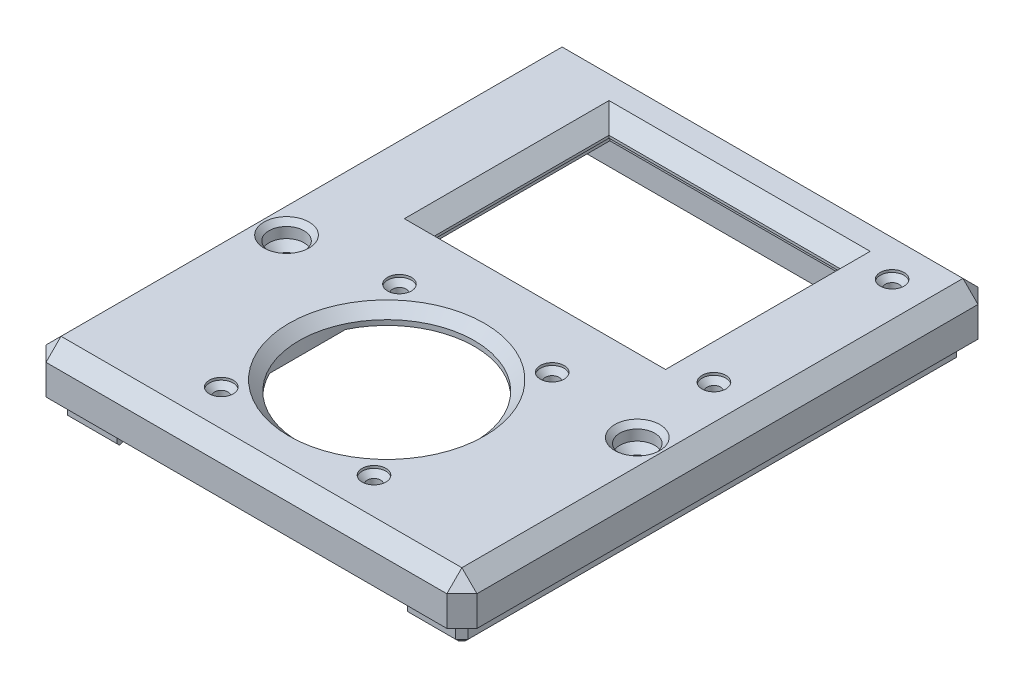
from build123d import *

# Parameters (mm, degrees)
SKETCH1_W                              = 86
SKETCH1_H                              = 106
MAIN_BASE_DEPTH                        = 9
ANO_MAIN_WHEEL_HOLE_DEPTH              = 69.840395118
ANO_MAIN_WHEEL_HOLE_DEPTH_BACK         = 69.840395118
SKETCH2_R                              = 17.5
ANO_MAIN_WHEEL_HOLE_CHAMFER_SIZE       = 2
ANO_MOUNT_HOLES_CUT_DEPTH              = 69.840395118
ANO_MOUNT_HOLES_CUT_DEPTH_BACK         = 69.840395118
SKETCH3_R                              = 1.35
ANO_BOARD_OFFSET_CUT_DEPTH             = 6
ANO_BOARD_INSERT_CUT_DEPTH             = 4
ANO_OFFSET_CHAMFER_SIZE                = 2
ANO_BOARD_INSERT_CHAMFER_SIZE          = 4
SKETCH7_R                              = 2.375
ANO_SCREW_COUNTERSINK_CUT_DEPTH        = 2.5
ANO_SCREW_COUNTERSINK_CHAMFER_SIZE     = 2
SKETCH8_W                              = 46.12
SKETCH8_H                              = 34.84
DISPLAY_MAIN_CUT_DEPTH                 = 69.840395118
DISPLAY_CHAMFER_SIZE                   = 3
SKETCH9_W                              = 56.2
SKETCH9_H                              = 41.1
DISPLAY_OFFSET_CUT_DEPTH               = 5.5
SKETCH10_R                             = 1.35
DISPLAY_MOUNT_HOLES_CUT_DEPTH          = 69.840395118
SKETCH14_R                             = 1.225
DISPLAY_SECONDARY_MOUNT_HOLES_DEPTH    = 6
SKETCH11_R                             = 2.375
DISPLAY_SCREW_COUNTERSINK_DEPTH        = 2.5
DISPLAY_SCREW_COUNTERSINK_CHAMFER_SIZE = 2
SKETCH13_W                             = 68.25
SKETCH13_H                             = 41.25
DISPLAY_SURFACE_OFFSET_CUT_DEPTH       = 2
DISPLAY_BACK_CHAMFER_SIZE              = 2
DISPLAY_WIRE_SPACER_CUT_DEPTH          = 3.5
FRONT_FACE_EDGE_CHAMFER_SIZE           = 3
SCREW_SEAT_LIP_EXTRUDE_DEPTH           = 5
SEAT_LIP_EDGE_EXTRUDE_DEPTH            = 5
SEAT_LIP_ENTRY_CHAMFER_SIZE            = 0.734562784
SEAT_LIP_ENTRY_CHAMFER_SIZE_2          = 1
SEAT_LIP_INNER_CHAMFER_SIZE            = 1
SEAT_LIP_BASE_CHAMFER_SIZE             = 1
SKETCH21_R                             = 2.1
BOX_MOUNTING_HOLE_CUT_DEPTH            = 70.670653793
SKETCH22_R                             = 3.5
BOX_MOUNTING_HOLE_COUNTERSINK_DEPTH    = 3
BOX_MOUNTING_HOLE_CHAMFER_SIZE         = 1
BOX_MOUNTING_HOLE_PRINT_CHAMFER_SIZE   = 1.5


# Some blends are built 0.0001 mm under size
with BuildPart() as part:
    # Sketch1 → Main Base (new body)
    with BuildSketch(Plane(origin=(0, 0, 0), x_dir=(1, 0, 0), z_dir=(0, 1, 0))):
        Rectangle(SKETCH1_W, SKETCH1_H)
    extrude(amount=MAIN_BASE_DEPTH)

    # Sketch2 → ANO Main Wheel Hole (cut, two sides: drawn at the far end of the back side and taken through both)
    with BuildSketch(Plane.XZ.offset(-ANO_MAIN_WHEEL_HOLE_DEPTH_BACK)):
        with Locations(Location((0, 25, 0), (0, 0, 270))):
            Circle(SKETCH2_R)
    extrude(amount=ANO_MAIN_WHEEL_HOLE_DEPTH + ANO_MAIN_WHEEL_HOLE_DEPTH_BACK, mode=Mode.SUBTRACT)

    # ANO Main Wheel Hole Chamfer
    ano_main_wheel_hole_chamfer_edges = [part.edges().sort_by_distance(p)[0] for p in [
        (0, 9, 42.5),
    ]]
    chamfer(ano_main_wheel_hole_chamfer_edges, length=ANO_MAIN_WHEEL_HOLE_CHAMFER_SIZE)

    # Sketch3 → ANO Mount Holes Cut (cut, two sides: drawn at the far end of the back side and taken through both)
    with BuildSketch(Plane.XZ.offset(-ANO_MOUNT_HOLES_CUT_DEPTH_BACK)):
        with Locations(Location((-15.24, 42.78, 0), (0, 0, 270))):
            Circle(SKETCH3_R)
        with Locations(Location((15.24, 42.78, 0), (0, 0, 270))):
            Circle(SKETCH3_R)
        with Locations(Location((15.24, 7.22, 0), (0, 0, 270))):
            Circle(SKETCH3_R)
        with Locations(Location((-15.24, 7.22, 0), (0, 0, 270))):
            Circle(SKETCH3_R)
    extrude(amount=ANO_MOUNT_HOLES_CUT_DEPTH + ANO_MOUNT_HOLES_CUT_DEPTH_BACK, mode=Mode.SUBTRACT)

    # Sketch6 → ANO Board Offset Cut (cut)
    with BuildSketch(Plane.XZ):
        with BuildLine():
            Line((-17.78, 25), (-17.78, 37.7))
            ThreePointArc((-17.78, 37.7), (-17.036051224, 39.496051224), (-15.24, 40.24))
            ThreePointArc((-15.24, 40.24), (-13.443948776, 40.983948776), (-12.7, 42.78))
            ThreePointArc((-12.7, 42.78), (-11.956051224, 44.576051224), (-10.16, 45.32))
            Line((-10.16, 45.32), (10.16, 45.32))
            ThreePointArc((10.16, 45.32), (11.956051224, 44.576051224), (12.7, 42.78))
            ThreePointArc((12.7, 42.78), (13.443948776, 40.983948776), (15.24, 40.24))
            ThreePointArc((15.24, 40.24), (17.036051224, 39.496051224), (17.78, 37.7))
            Line((17.78, 37.7), (17.78, 25))
            Line((17.78, 25), (17.78, 12.3))
            ThreePointArc((17.78, 12.3), (17.036051224, 10.503948776), (15.24, 9.76))
            ThreePointArc((15.24, 9.76), (13.443948776, 9.016051224), (12.7, 7.22))
            ThreePointArc((12.7, 7.22), (11.956051224, 5.423948776), (10.16, 4.68))
            Line((10.16, 4.68), (-10.16, 4.68))
            ThreePointArc((-10.16, 4.68), (-11.956051224, 5.423948776), (-12.7, 7.22))
            ThreePointArc((-12.7, 7.22), (-13.443948776, 9.016051224), (-15.24, 9.76))
            ThreePointArc((-15.24, 9.76), (-17.036051224, 10.503948776), (-17.78, 12.3))
            Line((-17.78, 12.3), (-17.78, 25))
        make_face()
    extrude(amount=-ANO_BOARD_OFFSET_CUT_DEPTH, mode=Mode.SUBTRACT)

    # Sketch12 → ANO Board Insert Cut (cut)
    with BuildSketch(Plane.XZ):
        with BuildLine():
            Line((18.28, 42.78), (18.28, 7.22))
            ThreePointArc((18.28, 7.22), (17.389604615, 5.070395385), (15.24, 4.18))
            Line((15.24, 4.18), (-15.24, 4.18))
            ThreePointArc((-15.24, 4.18), (-17.389604615, 5.070395385), (-18.28, 7.22))
            Line((-18.28, 7.22), (-18.28, 42.78))
            ThreePointArc((-18.28, 42.78), (-17.389604615, 44.929604615), (-15.24, 45.82))
            Line((-15.24, 45.82), (15.24, 45.82))
            ThreePointArc((15.24, 45.82), (17.389604615, 44.929604615), (18.28, 42.78))
        make_face()
    extrude(amount=-ANO_BOARD_INSERT_CUT_DEPTH, mode=Mode.SUBTRACT)

    # ANO Offset Chamfer
    # the kernel refuses this chamfer: 2 mm, written as the material it adds along each edge
    with BuildSketch(Plane(origin=(-10.16, 6, 42.78), x_dir=(-1, 0, 0), z_dir=(0, 0, -1))) as ano_offset_chamfer_piece_1_section:
        Polygon((2.54, -ANO_OFFSET_CHAMFER_SIZE), (2.54 - ANO_OFFSET_CHAMFER_SIZE, 0), (2.54, 0), align=None)
    ano_offset_chamfer_piece_1 = revolve(axis=Axis((-10.16, 6, 42.78), (0, 1, 0)), revolution_arc=90, mode=Mode.PRIVATE)
    ano_offset_chamfer_piece_1 = split(ano_offset_chamfer_piece_1, bisect_by=Plane(origin=(-10.16, 4, 42.78), z_dir=(0, 1, 0)), keep=Keep.TOP, mode=Mode.PRIVATE)
    add(ano_offset_chamfer_piece_1)
    with BuildSketch(Plane(origin=(-15.24, 6, 42.78), x_dir=(0, 0, -1), z_dir=(-1, 0, 0))) as ano_offset_chamfer_piece_2_section:
        Polygon((2.54, ANO_OFFSET_CHAMFER_SIZE), (2.54 + ANO_OFFSET_CHAMFER_SIZE, 0), (2.54, 0), align=None)
    ano_offset_chamfer_piece_2 = revolve(axis=Axis((-15.24, 6, 42.78), (0, -1, 0)), revolution_arc=90, mode=Mode.PRIVATE)
    ano_offset_chamfer_piece_2 = split(ano_offset_chamfer_piece_2, bisect_by=Plane(origin=(-15.24, 4, 42.78), z_dir=(0, 1, 0)), keep=Keep.TOP, mode=Mode.PRIVATE)
    add(ano_offset_chamfer_piece_2)
    with BuildSketch(Plane(origin=(-15.24, 6, 37.7), x_dir=(-1, 0, 0), z_dir=(0, 0, -1))) as ano_offset_chamfer_piece_3_section:
        Polygon((2.54, -ANO_OFFSET_CHAMFER_SIZE), (2.54 - ANO_OFFSET_CHAMFER_SIZE, 0), (2.54, 0), align=None)
    ano_offset_chamfer_piece_3 = revolve(axis=Axis((-15.24, 6, 37.7), (0, 1, 0)), revolution_arc=90, mode=Mode.PRIVATE)
    ano_offset_chamfer_piece_3 = split(ano_offset_chamfer_piece_3, bisect_by=Plane(origin=(-15.24, 4, 37.7), z_dir=(0, 1, 0)), keep=Keep.TOP, mode=Mode.PRIVATE)
    add(ano_offset_chamfer_piece_3)
    with BuildSketch(Plane(origin=(17.78, 6, 12.3), x_dir=(0, -1, 0), z_dir=(0, 0, 1))) as ano_offset_chamfer_piece_4_section:
        Polygon((ANO_OFFSET_CHAMFER_SIZE, 0), (0, -ANO_OFFSET_CHAMFER_SIZE), (0, 0), align=None)
    ano_offset_chamfer_piece_4 = extrude(amount=25.4, mode=Mode.PRIVATE)
    ano_offset_chamfer_piece_4 = split(ano_offset_chamfer_piece_4, bisect_by=Plane(origin=(17.78, 4, 12.3), z_dir=(0, 1, 0)), keep=Keep.TOP, mode=Mode.PRIVATE)
    ano_offset_chamfer_piece_4 = ano_offset_chamfer_piece_4 - Plane(origin=(0, 6, 25), x_dir=(0, 0, -1), z_dir=(0, -1, 0)) * Cylinder(17.5, 59, mode=Mode.PRIVATE)
    add(ano_offset_chamfer_piece_4)
    with BuildSketch(Plane(origin=(10.16, 6, 7.22), x_dir=(1, 0, 0), z_dir=(0, 0, 1))) as ano_offset_chamfer_piece_5_section:
        Polygon((2.54, -ANO_OFFSET_CHAMFER_SIZE), (2.54 - ANO_OFFSET_CHAMFER_SIZE, 0), (2.54, 0), align=None)
    ano_offset_chamfer_piece_5 = revolve(axis=Axis((10.16, 6, 7.22), (0, 1, 0)), revolution_arc=90, mode=Mode.PRIVATE)
    ano_offset_chamfer_piece_5 = split(ano_offset_chamfer_piece_5, bisect_by=Plane(origin=(10.16, 4, 7.22), z_dir=(0, 1, 0)), keep=Keep.TOP, mode=Mode.PRIVATE)
    add(ano_offset_chamfer_piece_5)
    with BuildSketch(Plane(origin=(10.16, 6, 4.68), x_dir=(0, -1, 0), z_dir=(-1, 0, 0))) as ano_offset_chamfer_piece_6_section:
        Polygon((ANO_OFFSET_CHAMFER_SIZE, 0), (0, ANO_OFFSET_CHAMFER_SIZE), (0, 0), align=None)
    ano_offset_chamfer_piece_6 = extrude(amount=20.32, mode=Mode.PRIVATE)
    ano_offset_chamfer_piece_6 = split(ano_offset_chamfer_piece_6, bisect_by=Plane(origin=(10.16, 4, 4.68), z_dir=(0, 1, 0)), keep=Keep.TOP, mode=Mode.PRIVATE)
    add(ano_offset_chamfer_piece_6)
    with BuildSketch(Plane(origin=(15.24, 6, 7.22), x_dir=(0, 0, 1), z_dir=(1, 0, 0))) as ano_offset_chamfer_piece_7_section:
        Polygon((2.54, ANO_OFFSET_CHAMFER_SIZE), (2.54 + ANO_OFFSET_CHAMFER_SIZE, 0), (2.54, 0), align=None)
    ano_offset_chamfer_piece_7 = revolve(axis=Axis((15.24, 6, 7.22), (0, -1, 0)), revolution_arc=90, mode=Mode.PRIVATE)
    ano_offset_chamfer_piece_7 = split(ano_offset_chamfer_piece_7, bisect_by=Plane(origin=(15.24, 4, 7.22), z_dir=(0, 1, 0)), keep=Keep.TOP, mode=Mode.PRIVATE)
    add(ano_offset_chamfer_piece_7)
    with BuildSketch(Plane(origin=(-10.16, 6, 7.22), x_dir=(0, 0, -1), z_dir=(1, 0, 0))) as ano_offset_chamfer_piece_8_section:
        Polygon((2.54, -ANO_OFFSET_CHAMFER_SIZE), (2.54 - ANO_OFFSET_CHAMFER_SIZE, 0), (2.54, 0), align=None)
    ano_offset_chamfer_piece_8 = revolve(axis=Axis((-10.16, 6, 7.22), (0, 1, 0)), revolution_arc=90, mode=Mode.PRIVATE)
    ano_offset_chamfer_piece_8 = split(ano_offset_chamfer_piece_8, bisect_by=Plane(origin=(-10.16, 4, 7.22), z_dir=(0, 1, 0)), keep=Keep.TOP, mode=Mode.PRIVATE)
    add(ano_offset_chamfer_piece_8)
    with BuildSketch(Plane(origin=(15.24, 6, 12.3), x_dir=(1, 0, 0), z_dir=(0, 0, 1))) as ano_offset_chamfer_piece_9_section:
        Polygon((2.54, -ANO_OFFSET_CHAMFER_SIZE), (2.54 - ANO_OFFSET_CHAMFER_SIZE, 0), (2.54, 0), align=None)
    ano_offset_chamfer_piece_9 = revolve(axis=Axis((15.24, 6, 12.3), (0, 1, 0)), revolution_arc=90, mode=Mode.PRIVATE)
    ano_offset_chamfer_piece_9 = split(ano_offset_chamfer_piece_9, bisect_by=Plane(origin=(15.24, 4, 12.3), z_dir=(0, 1, 0)), keep=Keep.TOP, mode=Mode.PRIVATE)
    add(ano_offset_chamfer_piece_9)
    with BuildSketch(Plane(origin=(-15.24, 6, 7.22), x_dir=(1, 0, 0), z_dir=(0, 0, -1))) as ano_offset_chamfer_piece_10_section:
        Polygon((2.54, ANO_OFFSET_CHAMFER_SIZE), (2.54 + ANO_OFFSET_CHAMFER_SIZE, 0), (2.54, 0), align=None)
    ano_offset_chamfer_piece_10 = revolve(axis=Axis((-15.24, 6, 7.22), (0, -1, 0)), revolution_arc=90, mode=Mode.PRIVATE)
    ano_offset_chamfer_piece_10 = split(ano_offset_chamfer_piece_10, bisect_by=Plane(origin=(-15.24, 4, 7.22), z_dir=(0, 1, 0)), keep=Keep.TOP, mode=Mode.PRIVATE)
    add(ano_offset_chamfer_piece_10)
    with BuildSketch(Plane(origin=(-15.24, 6, 12.3), x_dir=(0, 0, -1), z_dir=(1, 0, 0))) as ano_offset_chamfer_piece_11_section:
        Polygon((2.54, -ANO_OFFSET_CHAMFER_SIZE), (2.54 - ANO_OFFSET_CHAMFER_SIZE, 0), (2.54, 0), align=None)
    ano_offset_chamfer_piece_11 = revolve(axis=Axis((-15.24, 6, 12.3), (0, 1, 0)), revolution_arc=90, mode=Mode.PRIVATE)
    ano_offset_chamfer_piece_11 = split(ano_offset_chamfer_piece_11, bisect_by=Plane(origin=(-15.24, 4, 12.3), z_dir=(0, 1, 0)), keep=Keep.TOP, mode=Mode.PRIVATE)
    add(ano_offset_chamfer_piece_11)
    with BuildSketch(Plane(origin=(15.24, 6, 37.7), x_dir=(0, 0, 1), z_dir=(-1, 0, 0))) as ano_offset_chamfer_piece_12_section:
        Polygon((2.54, -ANO_OFFSET_CHAMFER_SIZE), (2.54 - ANO_OFFSET_CHAMFER_SIZE, 0), (2.54, 0), align=None)
    ano_offset_chamfer_piece_12 = revolve(axis=Axis((15.24, 6, 37.7), (0, 1, 0)), revolution_arc=90, mode=Mode.PRIVATE)
    ano_offset_chamfer_piece_12 = split(ano_offset_chamfer_piece_12, bisect_by=Plane(origin=(15.24, 4, 37.7), z_dir=(0, 1, 0)), keep=Keep.TOP, mode=Mode.PRIVATE)
    add(ano_offset_chamfer_piece_12)
    with BuildSketch(Plane(origin=(-17.78, 6, 37.7), x_dir=(0, -1, 0), z_dir=(0, 0, -1))) as ano_offset_chamfer_piece_13_section:
        Polygon((ANO_OFFSET_CHAMFER_SIZE, 0), (0, -ANO_OFFSET_CHAMFER_SIZE), (0, 0), align=None)
    ano_offset_chamfer_piece_13 = extrude(amount=25.4, mode=Mode.PRIVATE)
    ano_offset_chamfer_piece_13 = split(ano_offset_chamfer_piece_13, bisect_by=Plane(origin=(-17.78, 4, 37.7), z_dir=(0, 1, 0)), keep=Keep.TOP, mode=Mode.PRIVATE)
    ano_offset_chamfer_piece_13 = ano_offset_chamfer_piece_13 - Plane(origin=(0, 6, 25), x_dir=(0, 0, -1), z_dir=(0, -1, 0)) * Cylinder(17.5, 59, mode=Mode.PRIVATE)
    add(ano_offset_chamfer_piece_13)
    with BuildSketch(Plane(origin=(15.24, 6, 42.78), x_dir=(-1, 0, 0), z_dir=(0, 0, 1))) as ano_offset_chamfer_piece_14_section:
        Polygon((2.54, ANO_OFFSET_CHAMFER_SIZE), (2.54 + ANO_OFFSET_CHAMFER_SIZE, 0), (2.54, 0), align=None)
    ano_offset_chamfer_piece_14 = revolve(axis=Axis((15.24, 6, 42.78), (0, -1, 0)), revolution_arc=90, mode=Mode.PRIVATE)
    ano_offset_chamfer_piece_14 = split(ano_offset_chamfer_piece_14, bisect_by=Plane(origin=(15.24, 4, 42.78), z_dir=(0, 1, 0)), keep=Keep.TOP, mode=Mode.PRIVATE)
    add(ano_offset_chamfer_piece_14)
    with BuildSketch(Plane(origin=(10.16, 6, 42.78), x_dir=(0, 0, 1), z_dir=(-1, 0, 0))) as ano_offset_chamfer_piece_15_section:
        Polygon((2.54, -ANO_OFFSET_CHAMFER_SIZE), (2.54 - ANO_OFFSET_CHAMFER_SIZE, 0), (2.54, 0), align=None)
    ano_offset_chamfer_piece_15 = revolve(axis=Axis((10.16, 6, 42.78), (0, 1, 0)), revolution_arc=90, mode=Mode.PRIVATE)
    ano_offset_chamfer_piece_15 = split(ano_offset_chamfer_piece_15, bisect_by=Plane(origin=(10.16, 4, 42.78), z_dir=(0, 1, 0)), keep=Keep.TOP, mode=Mode.PRIVATE)
    add(ano_offset_chamfer_piece_15)
    with BuildSketch(Plane(origin=(-10.16, 6, 45.32), x_dir=(0, -1, 0), z_dir=(1, 0, 0))) as ano_offset_chamfer_piece_16_section:
        Polygon((ANO_OFFSET_CHAMFER_SIZE, 0), (0, ANO_OFFSET_CHAMFER_SIZE), (0, 0), align=None)
    ano_offset_chamfer_piece_16 = extrude(amount=20.32, mode=Mode.PRIVATE)
    ano_offset_chamfer_piece_16 = split(ano_offset_chamfer_piece_16, bisect_by=Plane(origin=(-10.16, 4, 45.32), z_dir=(0, 1, 0)), keep=Keep.TOP, mode=Mode.PRIVATE)
    add(ano_offset_chamfer_piece_16)

    # ANO Board Insert Chamfer
    ano_board_insert_chamfer_edges = [part.edges().sort_by_distance(p)[0] for p in [
        (0, 0, 4.18),
        (17.389604615, 0, 5.070395385),
        (-17.389604615, 0, 5.070395385),
        (18.28, 0, 25),
        (-18.28, 0, 25),
        (17.389604615, 0, 44.929604615),
        (-17.389604615, 0, 44.929604615),
        (0, 0, 45.82),
    ]]
    chamfer(ano_board_insert_chamfer_edges, length=ANO_BOARD_INSERT_CHAMFER_SIZE - 0.0001)  # a hair under: the kernel refuses the full size

    # Sketch7 → ANO Screw Countersink Cut (cut)
    with BuildSketch(Plane(origin=(0, 9, 0), x_dir=(1, 0, 0), z_dir=(0, 1, 0))):
        with Locations(Location((-15.24, -7.22, 0), (0, 0, 270))):
            Circle(SKETCH7_R)
        with Locations(Location((-15.24, -42.78, 0), (0, 0, 270))):
            Circle(SKETCH7_R)
        with Locations(Location((15.24, -42.78, 0), (0, 0, 270))):
            Circle(SKETCH7_R)
        with Locations(Location((15.24, -7.22, 0), (0, 0, 270))):
            Circle(SKETCH7_R)
    extrude(amount=-ANO_SCREW_COUNTERSINK_CUT_DEPTH, mode=Mode.SUBTRACT)

    # ANO Screw Countersink Chamfer
    # the kernel refuses this chamfer: 2 mm, written as the material it adds along each edge
    with BuildSketch(Plane(origin=(-15.24, 6.5, 42.78), x_dir=(0, 0, 1), z_dir=(-1, 0, 0))) as ano_screw_countersink_chamfer_piece_1_section:
        Polygon((2.375 - ANO_SCREW_COUNTERSINK_CHAMFER_SIZE, 0), (2.375, ANO_SCREW_COUNTERSINK_CHAMFER_SIZE), (2.375, 0), align=None)
    ano_screw_countersink_chamfer_piece_1 = revolve(axis=Axis((-15.24, 6.5, 42.78), (0, 1, 0)), mode=Mode.PRIVATE)
    ano_screw_countersink_chamfer_piece_1 = ano_screw_countersink_chamfer_piece_1 - Plane(origin=(-15.24, 6.5, 42.78), x_dir=(0, 0, -1), z_dir=(0, -1, 0)) * Cylinder(1.35, 10, mode=Mode.PRIVATE)
    add(ano_screw_countersink_chamfer_piece_1)
    with BuildSketch(Plane(origin=(15.24, 6.5, 42.78), x_dir=(0, 0, 1), z_dir=(-1, 0, 0))) as ano_screw_countersink_chamfer_piece_2_section:
        Polygon((2.375 - ANO_SCREW_COUNTERSINK_CHAMFER_SIZE, 0), (2.375, ANO_SCREW_COUNTERSINK_CHAMFER_SIZE), (2.375, 0), align=None)
    ano_screw_countersink_chamfer_piece_2 = revolve(axis=Axis((15.24, 6.5, 42.78), (0, 1, 0)), mode=Mode.PRIVATE)
    ano_screw_countersink_chamfer_piece_2 = ano_screw_countersink_chamfer_piece_2 - Plane(origin=(15.24, 6.5, 42.78), x_dir=(0, 0, -1), z_dir=(0, -1, 0)) * Cylinder(1.35, 10, mode=Mode.PRIVATE)
    add(ano_screw_countersink_chamfer_piece_2)
    with BuildSketch(Plane(origin=(15.24, 6.5, 7.22), x_dir=(0, 0, 1), z_dir=(-1, 0, 0))) as ano_screw_countersink_chamfer_piece_3_section:
        Polygon((2.375 - ANO_SCREW_COUNTERSINK_CHAMFER_SIZE, 0), (2.375, ANO_SCREW_COUNTERSINK_CHAMFER_SIZE), (2.375, 0), align=None)
    ano_screw_countersink_chamfer_piece_3 = revolve(axis=Axis((15.24, 6.5, 7.22), (0, 1, 0)), mode=Mode.PRIVATE)
    ano_screw_countersink_chamfer_piece_3 = ano_screw_countersink_chamfer_piece_3 - Plane(origin=(15.24, 6.5, 7.22), x_dir=(0, 0, -1), z_dir=(0, -1, 0)) * Cylinder(1.35, 10, mode=Mode.PRIVATE)
    add(ano_screw_countersink_chamfer_piece_3)
    with BuildSketch(Plane(origin=(-15.24, 6.5, 7.22), x_dir=(0, 0, 1), z_dir=(-1, 0, 0))) as ano_screw_countersink_chamfer_piece_4_section:
        Polygon((2.375 - ANO_SCREW_COUNTERSINK_CHAMFER_SIZE, 0), (2.375, ANO_SCREW_COUNTERSINK_CHAMFER_SIZE), (2.375, 0), align=None)
    ano_screw_countersink_chamfer_piece_4 = revolve(axis=Axis((-15.24, 6.5, 7.22), (0, 1, 0)), mode=Mode.PRIVATE)
    ano_screw_countersink_chamfer_piece_4 = ano_screw_countersink_chamfer_piece_4 - Plane(origin=(-15.24, 6.5, 7.22), x_dir=(0, 0, -1), z_dir=(0, -1, 0)) * Cylinder(1.35, 10, mode=Mode.PRIVATE)
    add(ano_screw_countersink_chamfer_piece_4)

    # Sketch8 → Display Main Cut (cut, through all)
    with BuildSketch(Plane(origin=(0, 9, 0), x_dir=(1, 0, 0), z_dir=(0, 1, 0))):
        with Locations((0, 25)):
            Rectangle(SKETCH8_W, SKETCH8_H)
    extrude(amount=-DISPLAY_MAIN_CUT_DEPTH, mode=Mode.SUBTRACT)

    # Display Chamfer
    display_chamfer_edges = [part.edges().sort_by_distance(p)[0] for p in [
        (-23.06, 9, -25),
        (0, 9, -7.58),
        (23.06, 9, -25),
        (0, 9, -42.42),
    ]]
    chamfer(display_chamfer_edges, length=DISPLAY_CHAMFER_SIZE)

    # Sketch9 → Display Offset Cut (cut)
    with BuildSketch(Plane.XZ):
        with Locations((2.08, -25)):
            Rectangle(SKETCH9_W, SKETCH9_H)
    extrude(amount=-DISPLAY_OFFSET_CUT_DEPTH, mode=Mode.SUBTRACT)

    # Sketch10 → Display Mount Holes Cut (cut, through all)
    with BuildSketch(Plane.XZ):
        with Locations(Location((33.08, -42.78, 0), (0, 0, 270))):
            Circle(SKETCH10_R)
        with Locations(Location((33.08, -7.22, 0), (0, 0, 270))):
            Circle(SKETCH10_R)
    extrude(amount=-DISPLAY_MOUNT_HOLES_CUT_DEPTH, mode=Mode.SUBTRACT)

    # Sketch14 → Display Secondary Mount Holes (cut)
    with BuildSketch(Plane.XZ):
        with Locations(Location((-27.88, -7.22, 0), (0, 0, 270))):
            Circle(SKETCH14_R)
        with Locations(Location((-27.88, -42.78, 0), (0, 0, 270))):
            Circle(SKETCH14_R)
    extrude(amount=-DISPLAY_SECONDARY_MOUNT_HOLES_DEPTH, mode=Mode.SUBTRACT)

    # Sketch11 → Display Screw Countersink (cut)
    with BuildSketch(Plane(origin=(0, 9, 0), x_dir=(1, 0, 0), z_dir=(0, 1, 0))):
        with Locations(Location((33.08, 42.78, 0), (0, 0, 270))):
            Circle(SKETCH11_R)
        with Locations(Location((33.08, 7.22, 0), (0, 0, 270))):
            Circle(SKETCH11_R)
    extrude(amount=-DISPLAY_SCREW_COUNTERSINK_DEPTH, mode=Mode.SUBTRACT)

    # Display Screw Countersink Chamfer
    # the kernel refuses this chamfer: 2 mm, written as the material it adds along each edge
    with BuildSketch(Plane(origin=(33.08, 6.5, -42.78), x_dir=(0, 0, 1), z_dir=(-1, 0, 0))) as display_screw_countersink_chamfer_piece_1_section:
        Polygon((2.375, DISPLAY_SCREW_COUNTERSINK_CHAMFER_SIZE), (2.375 - DISPLAY_SCREW_COUNTERSINK_CHAMFER_SIZE, 0), (2.375, 0), align=None)
    display_screw_countersink_chamfer_piece_1 = revolve(axis=Axis((33.08, 6.5, -42.78), (0, 1, 0)), mode=Mode.PRIVATE)
    display_screw_countersink_chamfer_piece_1 = display_screw_countersink_chamfer_piece_1 - Plane(origin=(33.08, 6.5, -42.78), x_dir=(0, 0, -1), z_dir=(0, -1, 0)) * Cylinder(1.35, 10, mode=Mode.PRIVATE)
    add(display_screw_countersink_chamfer_piece_1)
    with BuildSketch(Plane(origin=(33.08, 6.5, -7.22), x_dir=(0, 0, 1), z_dir=(-1, 0, 0))) as display_screw_countersink_chamfer_piece_2_section:
        Polygon((2.375, DISPLAY_SCREW_COUNTERSINK_CHAMFER_SIZE), (2.375 - DISPLAY_SCREW_COUNTERSINK_CHAMFER_SIZE, 0), (2.375, 0), align=None)
    display_screw_countersink_chamfer_piece_2 = revolve(axis=Axis((33.08, 6.5, -7.22), (0, 1, 0)), mode=Mode.PRIVATE)
    display_screw_countersink_chamfer_piece_2 = display_screw_countersink_chamfer_piece_2 - Plane(origin=(33.08, 6.5, -7.22), x_dir=(0, 0, -1), z_dir=(0, -1, 0)) * Cylinder(1.35, 10, mode=Mode.PRIVATE)
    add(display_screw_countersink_chamfer_piece_2)

    # Sketch13 → Display Surface Offset Cut (cut)
    with BuildSketch(Plane.XZ):
        with Locations((2.6, -25)):
            Rectangle(SKETCH13_W, SKETCH13_H)
    extrude(amount=-DISPLAY_SURFACE_OFFSET_CUT_DEPTH, mode=Mode.SUBTRACT)

    # Display Back Chamfer
    display_back_chamfer_edges = [part.edges().sort_by_distance(p)[0] for p in [
        (36.725, 0, -25),
        (2.6, 0, -45.625),
        (-31.525, 0, -25),
        (2.6, 0, -4.375),
    ]]
    chamfer(display_back_chamfer_edges, length=DISPLAY_BACK_CHAMFER_SIZE - 0.0001)  # a hair under: the kernel refuses the full size

    # Sketch16 → Display Wire Spacer Cut (cut)
    with BuildSketch(Plane.XZ.offset(-2)):
        with BuildLine():
            Line((36.725, -13.765), (36.725, -36.235))
            ThreePointArc((36.725, -36.235), (35.657404217, -38.812404217), (33.08, -39.88))
            ThreePointArc((33.08, -39.88), (31.029390335, -40.729390335), (30.18, -42.78))
            Line((30.18, -42.78), (30.18, -7.22))
            ThreePointArc((30.18, -7.22), (31.029390335, -9.270609665), (33.08, -10.12))
            ThreePointArc((33.08, -10.12), (35.657404217, -11.187595783), (36.725, -13.765))
        make_face()
    extrude(amount=-DISPLAY_WIRE_SPACER_CUT_DEPTH, mode=Mode.SUBTRACT)

    # Front Face Edge Chamfer
    front_face_edge_chamfer_edges = [part.edges().sort_by_distance(p)[0] for p in [
        (43, 9, 0),
        (0, 9, -53),
        (-43, 9, 0),
        (-43, 4.5, -53),
        (43, 4.5, -53),
        (43, 4.5, 53),
        (-43, 4.5, 53),
        (0, 9, 53),
    ]]
    chamfer(front_face_edge_chamfer_edges, length=FRONT_FACE_EDGE_CHAMFER_SIZE)

    # Sketch19 → Screw Seat Lip Extrude (add)
    with BuildSketch(Plane.XZ):
        with BuildLine():
            Line((38.757359313, 50), (40, 48.757359313))
            Line((40, 48.757359313), (40, 10))
            ThreePointArc((40, 10), (35, 5), (30, 10))
            Line((30, 10), (30, 42.78))
            ThreePointArc((30, 42.78), (29.52061133, 46.511184805), (28.113585359, 50))
            Line((28.113585359, 50), (38.757359313, 50))
        make_face()
        with BuildLine():
            Line((-30, 42.78), (-30, 10))
            ThreePointArc((-30, 10), (-35, 5), (-40, 10))
            Line((-40, 10), (-40, 48.757359313))
            Line((-40, 48.757359313), (-38.757359313, 50))
            Line((-38.757359313, 50), (-28.113585359, 50))
            ThreePointArc((-28.113585359, 50), (-29.52061133, 46.511184805), (-30, 42.78))
        make_face()
    extrude(amount=SCREW_SEAT_LIP_EXTRUDE_DEPTH)

    # Sketch20 → Seat Lip Edge Extrude (add)
    with BuildSketch(Plane.XZ):
        with BuildLine():
            Line((38.757359313, -48), (-37.928932188, -48))
            Line((-37.928932188, -48), (-38.585786438, -47.343145751))
            Line((-38.585786438, -47.343145751), (-38.585786438, 6.515443267))
            ThreePointArc((-38.585786438, 6.515443267), (-39.632975944, 8.119698453), (-40, 10))
            Line((-40, 10), (-40, -48.757359313))
            Line((-40, -48.757359313), (-38.757359313, -50))
            Line((-38.757359313, -50), (38.757359313, -50))
            Line((38.757359313, -50), (40, -48.757359313))
            Line((40, -48.757359313), (40, 10))
            ThreePointArc((40, 10), (39.679038179, 8.237444549), (38.757359313, 6.701174301))
            Line((38.757359313, 6.701174301), (38.757359313, -48))
        make_face()
    extrude(amount=SEAT_LIP_EDGE_EXTRUDE_DEPTH)

    # Seat Lip Entry Chamfer
    # the kernel refuses this chamfer: 1, 0.734562784 mm, written as the material it takes off along each edge
    with BuildSketch(Plane(origin=(-28.113585359, 0, 50), x_dir=(-1, 0, 0), z_dir=(0, -1, 0))) as seat_lip_entry_chamfer_piece_1:
        with BuildLine():
            Line((SEAT_LIP_ENTRY_CHAMFER_SIZE, 0), (0.475204545, 0.921793264))
            ThreePointArc((0.475204545, 0.921793264), (0.252408403, 0.469749059), (0, 0))
            Line((0, 0), (SEAT_LIP_ENTRY_CHAMFER_SIZE, 0))
        make_face()
    extrude(amount=7.66670762, mode=Mode.SUBTRACT)
    with BuildSketch(Plane(origin=(-41.329042301, -5, 50), x_dir=(0, 0, -1), z_dir=(1, 0, 0)), Plane(origin=(25.541902371, -5, 50), x_dir=(0, 0, -1), z_dir=(1, 0, 0))) as seat_lip_entry_chamfer_piece_2:
        Polygon((SEAT_LIP_ENTRY_CHAMFER_SIZE_2, 0), (0, SEAT_LIP_ENTRY_CHAMFER_SIZE_2), (0, 0), align=None)
    extrude(amount=15.78713993, mode=Mode.SUBTRACT)
    with BuildSketch(Plane(origin=(-41.81845448, -5, 46.938904833), x_dir=(0.7071067811865456, 0, -0.7071067811865496), z_dir=(0.7071067811865496, 0, 0.7071067811865455)), Plane(origin=(36.938904833, -5, 51.81845448), x_dir=(-0.7071067811865436, 0, -0.7071067811865516), z_dir=(0.7071067811865516, 0, -0.7071067811865435))) as seat_lip_entry_chamfer_piece_3:
        Polygon((SEAT_LIP_ENTRY_CHAMFER_SIZE_2, 0), (0, SEAT_LIP_ENTRY_CHAMFER_SIZE_2), (0, 0), align=None)
    extrude(amount=6.900725289, mode=Mode.SUBTRACT)
    with BuildSketch(Plane(origin=(-40, -5, -51.329042301), x_dir=(1, 0, 0), z_dir=(0, 0, 1)), Plane(origin=(40, -5, 51.329042301), x_dir=(-1, 0, 0), z_dir=(0, 0, -1))) as seat_lip_entry_chamfer_piece_4:
        Polygon((SEAT_LIP_ENTRY_CHAMFER_SIZE_2, 0), (0, SEAT_LIP_ENTRY_CHAMFER_SIZE_2), (0, 0), align=None)
    extrude(amount=102.658084602, mode=Mode.SUBTRACT)
    with BuildSketch(Plane(origin=(-41.81845448, -5, -46.938904833), x_dir=(0.7071067811865457, 0, 0.7071067811865497), z_dir=(0.7071067811865496, 0, -0.7071067811865456)), Plane(origin=(36.938904833, -5, -51.81845448), x_dir=(-0.7071067811865457, 0, 0.7071067811865497), z_dir=(0.7071067811865496, 0, 0.7071067811865456))) as seat_lip_entry_chamfer_piece_5:
        Polygon((SEAT_LIP_ENTRY_CHAMFER_SIZE_2, 0), (0, -SEAT_LIP_ENTRY_CHAMFER_SIZE_2), (0, 0), align=None)
    extrude(amount=6.900725289, mode=Mode.SUBTRACT)
    with BuildSketch(Plane(origin=(-41.329042301, -5, -50), x_dir=(0, 0, 1), z_dir=(1, 0, 0))) as seat_lip_entry_chamfer_piece_6:
        Polygon((SEAT_LIP_ENTRY_CHAMFER_SIZE_2, 0), (0, -SEAT_LIP_ENTRY_CHAMFER_SIZE_2), (0, 0), align=None)
    extrude(amount=82.658084602, mode=Mode.SUBTRACT)
    with BuildSketch(Plane(origin=(28.113585359, 0, 50), x_dir=(0.467141784953538, 0, -0.8841824205165031), z_dir=(0, -1, 0))) as seat_lip_entry_chamfer_piece_7:
        with BuildLine():
            Line((0.740014865, 0), (SEAT_LIP_ENTRY_CHAMFER_SIZE_2 * 0.467141784954, SEAT_LIP_ENTRY_CHAMFER_SIZE_2 * 0.884182420517))
            Line((SEAT_LIP_ENTRY_CHAMFER_SIZE_2 * 0.467141784954, SEAT_LIP_ENTRY_CHAMFER_SIZE_2 * 0.884182420517), (0, 0))
            ThreePointArc((0, 0), (0.375914782, 0.004637267), (0.740014865, 0))
        make_face()
    extrude(amount=7.571682988, mode=Mode.SUBTRACT)

    # Seat Lip Inner Chamfer
    # the kernel refuses this chamfer: 1 mm, written as the material it adds along each edge
    with BuildSketch(Plane(origin=(35, 0, 10), x_dir=(0.9789226269879785, 0, -0.20423146273518972), z_dir=(0.20423146273518972, 0, 0.9789226269879785))) as seat_lip_inner_chamfer_piece_1_section:
        Polygon((5 + SEAT_LIP_INNER_CHAMFER_SIZE, 0), (5, -SEAT_LIP_INNER_CHAMFER_SIZE), (5, 0), align=None)
    seat_lip_inner_chamfer_piece_1 = revolve(axis=Axis((35, 0, 10), (0, 1, 0)), revolution_arc=168.215486685, mode=Mode.PRIVATE)
    seat_lip_inner_chamfer_piece_1 = split(seat_lip_inner_chamfer_piece_1, bisect_by=Plane(origin=(38.757359313, 0, 10), z_dir=(-1, 0, 0)), keep=Keep.TOP, mode=Mode.PRIVATE)
    add(seat_lip_inner_chamfer_piece_1)
    with BuildSketch(Plane(origin=(30, 0, 10), x_dir=(-1, 0, 0), z_dir=(0, 0, 1)), Plane(origin=(-30, 0, 42.78), x_dir=(1, 0, 0), z_dir=(0, 0, -1))) as seat_lip_inner_chamfer_piece_2:
        Polygon((SEAT_LIP_INNER_CHAMFER_SIZE, 0), (0, SEAT_LIP_INNER_CHAMFER_SIZE), (0, 0), align=None)
    extrude(amount=32.78)
    with BuildSketch(Plane(origin=(15.24, 0, 42.78), x_dir=(1, 0, 0), z_dir=(0, 0, -1))) as seat_lip_inner_chamfer_piece_3_section:
        Polygon((14.76 - SEAT_LIP_INNER_CHAMFER_SIZE, 0), (14.76, SEAT_LIP_INNER_CHAMFER_SIZE), (14.76, 0), align=None)
    seat_lip_inner_chamfer_piece_3 = revolve(axis=Axis((15.24, 0, 42.78), (0, -1, 0)), revolution_arc=36.395643359, mode=Mode.PRIVATE)
    seat_lip_inner_chamfer_piece_3 = split(seat_lip_inner_chamfer_piece_3, bisect_by=Plane(origin=(18.56679268, 0, 39.45320732), z_dir=(0.707106781186062, 0, -0.7071067811870332)), keep=Keep.TOP, mode=Mode.PRIVATE)
    add(seat_lip_inner_chamfer_piece_3)
    with BuildSketch(Plane(origin=(-38.585786438, 0, -49.914828738), x_dir=(1, 0, 0), z_dir=(0, 0, 1))) as seat_lip_inner_chamfer_piece_4:
        Polygon((SEAT_LIP_INNER_CHAMFER_SIZE, 0), (0, -SEAT_LIP_INNER_CHAMFER_SIZE), (0, 0), align=None)
    extrude(amount=59.001954994)
    with BuildSketch(Plane(origin=(-35, 0, 10), x_dir=(1, 0, 0), z_dir=(0, 0, 1))) as seat_lip_inner_chamfer_piece_5_section:
        Polygon((5 + SEAT_LIP_INNER_CHAMFER_SIZE, 0), (5, -SEAT_LIP_INNER_CHAMFER_SIZE), (5, 0), align=None)
    seat_lip_inner_chamfer_piece_5 = revolve(axis=Axis((-35, 0, 10), (0, 1, 0)), revolution_arc=165.316563106, mode=Mode.PRIVATE)
    seat_lip_inner_chamfer_piece_5 = split(seat_lip_inner_chamfer_piece_5, bisect_by=Plane(origin=(-38.585786438, 0, 10), z_dir=(1, 0, 0)), keep=Keep.TOP, mode=Mode.PRIVATE)
    add(seat_lip_inner_chamfer_piece_5)
    with BuildSketch(Plane(origin=(-15.24, 0, 42.78), x_dir=(-0.8167225913511158, 0, 0.5770305093985226), z_dir=(0.5770305093985226, 0, 0.8167225913511158))) as seat_lip_inner_chamfer_piece_6_section:
        Polygon((14.76 - SEAT_LIP_INNER_CHAMFER_SIZE, 0), (14.76, SEAT_LIP_INNER_CHAMFER_SIZE), (14.76, 0), align=None)
    seat_lip_inner_chamfer_piece_6 = revolve(axis=Axis((-15.24, 0, 42.78), (0, -1, 0)), revolution_arc=35.241954376, mode=Mode.PRIVATE)
    seat_lip_inner_chamfer_piece_6 = split(seat_lip_inner_chamfer_piece_6, bisect_by=Plane(origin=(-25.967469689, 0, 39.7616902), z_dir=(-0.9626226602594182, 0, -0.27084610751325316)), keep=Keep.TOP, mode=Mode.PRIVATE)
    add(seat_lip_inner_chamfer_piece_6)
    # the kernel refuses this chamfer: 1 mm, written as the material it takes off along each edge
    with BuildSketch(Plane(origin=(15.24, -5, 42.78), x_dir=(1, 0, 0), z_dir=(0, 0, -1))) as seat_lip_inner_chamfer_2_piece_1:
        Polygon((14.76, -SEAT_LIP_INNER_CHAMFER_SIZE), (14.76 + SEAT_LIP_INNER_CHAMFER_SIZE, 0), (14.76, 0), align=None)
    revolve(axis=Axis((15.24, -5, 42.78), (0, -1, 0)), revolution_arc=34.906727258, mode=Mode.SUBTRACT)
    with BuildSketch(Plane(origin=(35, -5, 10), x_dir=(0.9789226269879785, 0, -0.20423146273518972), z_dir=(0.20423146273518972, 0, 0.9789226269879785))) as seat_lip_inner_chamfer_2_piece_2_section:
        Polygon((5, SEAT_LIP_INNER_CHAMFER_SIZE), (5 - SEAT_LIP_INNER_CHAMFER_SIZE, 0), (5, 0), align=None)
    seat_lip_inner_chamfer_2_piece_2 = revolve(axis=Axis((35, -5, 10), (0, 1, 0)), revolution_arc=168.215486685, mode=Mode.PRIVATE)
    seat_lip_inner_chamfer_2_piece_2 = split(seat_lip_inner_chamfer_2_piece_2, bisect_by=Plane(origin=(38.757359313, -5, 10), z_dir=(-1, 0, 0)), keep=Keep.TOP, mode=Mode.PRIVATE)
    add(seat_lip_inner_chamfer_2_piece_2, mode=Mode.SUBTRACT)
    with BuildSketch(Plane(origin=(30, -5, 10), x_dir=(0, 1, 0), z_dir=(0, 0, 1)), Plane(origin=(-30, -5, 42.78), x_dir=(0, 1, 0), z_dir=(0, 0, -1))) as seat_lip_inner_chamfer_2_piece_3:
        Polygon((SEAT_LIP_INNER_CHAMFER_SIZE, 0), (0, -SEAT_LIP_INNER_CHAMFER_SIZE), (0, 0), align=None)
    extrude(amount=32.78, mode=Mode.SUBTRACT)
    with BuildSketch(Plane(origin=(-35, -5, 10), x_dir=(1, 0, 0), z_dir=(0, 0, 1))) as seat_lip_inner_chamfer_2_piece_4_section:
        Polygon((5 - SEAT_LIP_INNER_CHAMFER_SIZE, 0), (5, SEAT_LIP_INNER_CHAMFER_SIZE), (5, 0), align=None)
    seat_lip_inner_chamfer_2_piece_4 = revolve(axis=Axis((-35, -5, 10), (0, 1, 0)), revolution_arc=165.316563106, mode=Mode.PRIVATE)
    seat_lip_inner_chamfer_2_piece_4 = split(seat_lip_inner_chamfer_2_piece_4, bisect_by=Plane(origin=(-38.585786438, -5, 10), z_dir=(1, 0, 0)), keep=Keep.TOP, mode=Mode.PRIVATE)
    add(seat_lip_inner_chamfer_2_piece_4, mode=Mode.SUBTRACT)
    with BuildSketch(Plane(origin=(-15.24, -5, 42.78), x_dir=(-0.8200846929716497, 0, 0.572242165829813), z_dir=(0.572242165829813, 0, 0.8200846929716497))) as seat_lip_inner_chamfer_2_piece_5:
        Polygon((14.76, -SEAT_LIP_INNER_CHAMFER_SIZE), (14.76 + SEAT_LIP_INNER_CHAMFER_SIZE, 0), (14.76, 0), align=None)
    revolve(axis=Axis((-15.24, -5, 42.78), (0, -1, 0)), revolution_arc=34.906727258, mode=Mode.SUBTRACT)

    # Seat Lip Base Chamfer
    seat_lip_base_chamfer_edges = [part.edges().sort_by_distance(p)[0] for p in [
        (-39.378679656, 0, 49.378679656),
        (-40, 0, 0),
        (40, 0, 0),
        (39.378679656, 0, 49.378679656),
        (33.935472336, 0, 50),
        (-39.378679656, 0, -49.378679656),
        (0, 0, -50),
        (39.378679656, 0, -49.378679656),
        (-33.802753728, 0, 50),
    ]]
    chamfer(seat_lip_base_chamfer_edges, length=SEAT_LIP_BASE_CHAMFER_SIZE)

    # Sketch21 → Box Mounting Hole Cut (cut, through all)
    with BuildSketch(Plane.XZ.offset(5)):
        with Locations(Location((-35, 10, 0), (0, 0, 270))):
            Circle(SKETCH21_R)
        with Locations(Location((35, 10, 0), (0, 0, 270))):
            Circle(SKETCH21_R)
    extrude(amount=-BOX_MOUNTING_HOLE_CUT_DEPTH, mode=Mode.SUBTRACT)

    # Sketch22 → Box Mounting Hole Countersink (cut)
    with BuildSketch(Plane(origin=(0, 9, 0), x_dir=(1, 0, 0), z_dir=(0, 1, 0))):
        with Locations(Location((-35, -10, 0), (0, 0, 270))):
            Circle(SKETCH22_R)
        with Locations(Location((35, -10, 0), (0, 0, 270))):
            Circle(SKETCH22_R)
    extrude(amount=-BOX_MOUNTING_HOLE_COUNTERSINK_DEPTH, mode=Mode.SUBTRACT)

    # Box Mounting Hole Chamfer
    box_mounting_hole_chamfer_edges = [part.edges().sort_by_distance(p)[0] for p in [
        (-35, 9, 6.5),
        (35, 9, 6.5),
    ]]
    chamfer(box_mounting_hole_chamfer_edges, length=BOX_MOUNTING_HOLE_CHAMFER_SIZE)

    # Box Mounting Hole Print Chamfer
    # the kernel refuses this chamfer: 1.5 mm, written as the material it takes off along each edge
    with BuildSketch(Plane(origin=(35, 6, 10), x_dir=(0, 0, -1), z_dir=(-1, 0, 0))) as box_mounting_hole_print_chamfer_piece_1_section:
        Polygon((2.1 + BOX_MOUNTING_HOLE_PRINT_CHAMFER_SIZE, 0), (2.1, BOX_MOUNTING_HOLE_PRINT_CHAMFER_SIZE), (2.1, 0), align=None)
    box_mounting_hole_print_chamfer_piece_1 = revolve(axis=Axis((35, 6, 10), (0, -1, 0)), mode=Mode.PRIVATE)
    box_mounting_hole_print_chamfer_piece_1 = box_mounting_hole_print_chamfer_piece_1 & Plane(origin=(35, 6, 10), x_dir=(0, 0, 1), z_dir=(0, 1, 0)) * Cylinder(3.5, 15, mode=Mode.PRIVATE)
    add(box_mounting_hole_print_chamfer_piece_1, mode=Mode.SUBTRACT)
    with BuildSketch(Plane(origin=(-35, 6, 10), x_dir=(0, 0, -1), z_dir=(-1, 0, 0))) as box_mounting_hole_print_chamfer_piece_2_section:
        Polygon((2.1 + BOX_MOUNTING_HOLE_PRINT_CHAMFER_SIZE, 0), (2.1, BOX_MOUNTING_HOLE_PRINT_CHAMFER_SIZE), (2.1, 0), align=None)
    box_mounting_hole_print_chamfer_piece_2 = revolve(axis=Axis((-35, 6, 10), (0, -1, 0)), mode=Mode.PRIVATE)
    box_mounting_hole_print_chamfer_piece_2 = box_mounting_hole_print_chamfer_piece_2 & Plane(origin=(-35, 6, 10), x_dir=(0, 0, 1), z_dir=(0, 1, 0)) * Cylinder(3.5, 15, mode=Mode.PRIVATE)
    add(box_mounting_hole_print_chamfer_piece_2, mode=Mode.SUBTRACT)


solid = part.part
